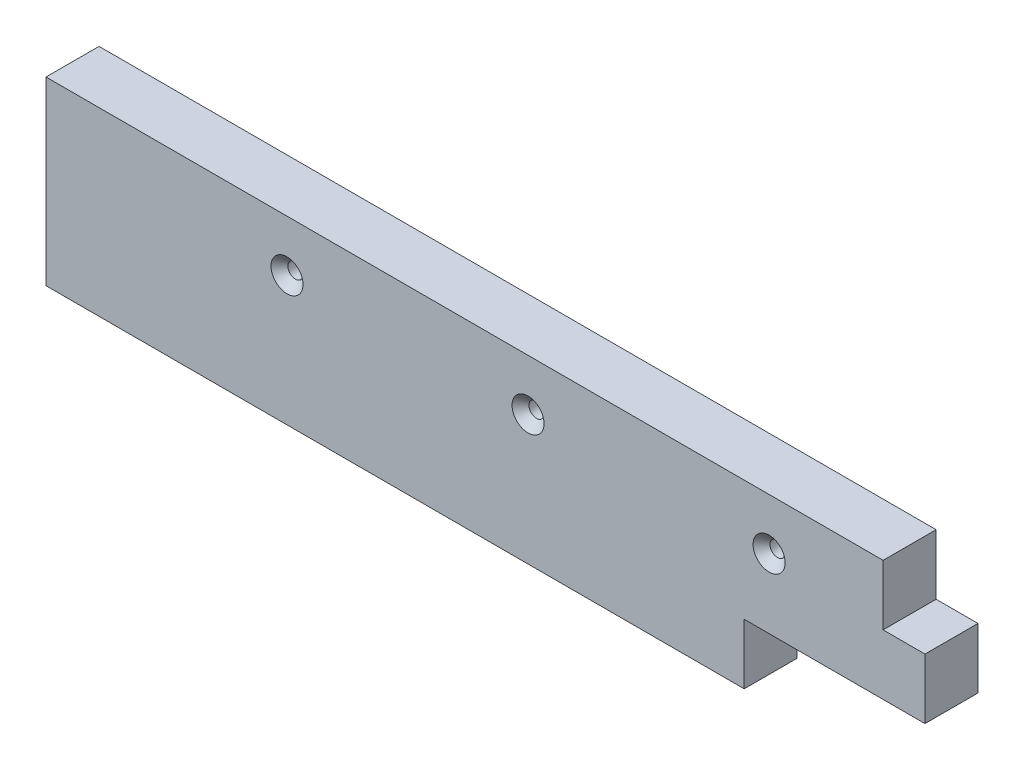
from build123d import *

# Parameters (mm, degrees)
SKETCH1_W                                            = 370.50412818
SKETCH1_H                                            = 22.352
BOSS_EXTRUDE1_DEPTH                                  = 38.1
CSK_FOR_M6_HEX_SOCKET_COUNTERSUNK_HEAD_S_D           = 6.4
CSK_FOR_M6_HEX_SOCKET_COUNTERSUNK_HEAD_S_CSINK_D     = 13.5
CSK_FOR_M6_HEX_SOCKET_COUNTERSUNK_HEAD_S_CSINK_ANGLE = 90
SKETCH3_W                                            = 17.645707914
SKETCH3_H                                            = 25.4
SKETCH3_W_2                                          = 76.2
CUT_EXTRUDE1_DEPTH                                   = 191.445659319


with BuildPart() as part:
    # Sketch1 → Boss-Extrude1 (new, symmetric)
    with BuildSketch(Plane(origin=(0, 0, 0), x_dir=(1, 0, 0), z_dir=(0, 1, 0))):
        Rectangle(SKETCH1_W, SKETCH1_H)
    extrude(amount=BOSS_EXTRUDE1_DEPTH, both=True)

    # CSK for M6 Hex Socket Countersunk Head Screw6 (through all)
    with Locations(Plane.XY.offset(11.176)):
        with Locations((-83.652063971, 16.50746), (17.947936029, 16.50746), (119.547936029, 16.50746)):
            CounterSinkHole(CSK_FOR_M6_HEX_SOCKET_COUNTERSUNK_HEAD_S_D / 2, CSK_FOR_M6_HEX_SOCKET_COUNTERSUNK_HEAD_S_CSINK_D / 2, counter_sink_angle=CSK_FOR_M6_HEX_SOCKET_COUNTERSUNK_HEAD_S_CSINK_ANGLE)

    # Sketch3 → Cut-Extrude1 (cut, through all)
    with BuildSketch(Plane.XY.offset(11.176)):
        with Locations((176.429210133, 25.4)):
            Rectangle(SKETCH3_W, SKETCH3_H)
        with Locations((147.15206409, -25.4)):
            Rectangle(SKETCH3_W_2, SKETCH3_H)
    extrude(amount=-CUT_EXTRUDE1_DEPTH, mode=Mode.SUBTRACT)


solid = part.part
